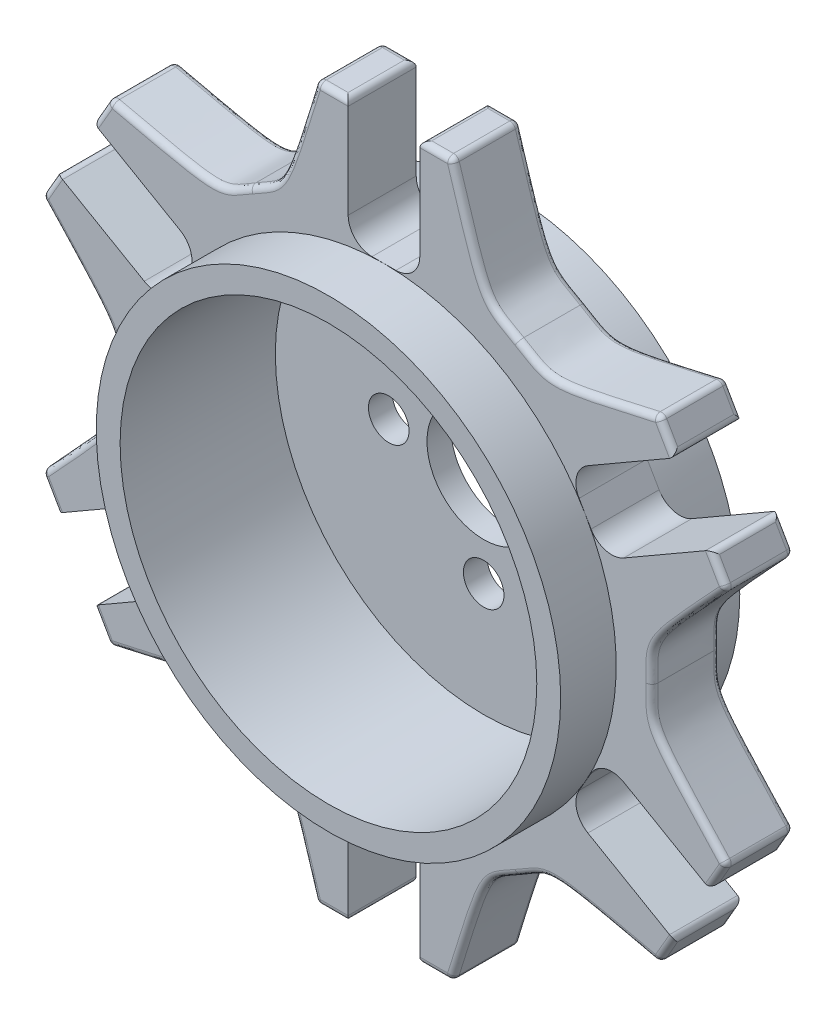
from build123d import *

# Parameters (mm, degrees)
SKETCH_1_R                       = 19.45
EXTRUDE_1_DEPTH                  = 15
SHELL_1_T                        = -2
SKETCH_2_R                       = 4.75
SKETCH_2_R_2                     = 1.7
CUT_EXTRUDE_2_DEPTH              = 15
EXTRUDE_4_DEPTH                  = 2.85
FILLET_2_R                       = 0.5
PATTERN_CIRCULAR_8_COUNT         = 6
FILLET_2_OF_PATTERN_CIRCULAR_8_R = 0.5


with BuildPart() as part:
    # 草圖1 → 伸長1 (new body)
    with BuildSketch(Plane.XY):
        Circle(SKETCH_1_R)
    extrude(amount=EXTRUDE_1_DEPTH)

    # 薄殼1
    shell_1_openings = [part.faces().sort_by_distance(p)[0] for p in [
        (0, 0, 15),
    ]]
    offset(amount=SHELL_1_T, openings=shell_1_openings, kind=Kind.INTERSECTION)

    # 草圖2 → 伸長2 (cut)
    with BuildSketch(Plane(origin=(0, 0, 0), x_dir=(-1, 0, 0), z_dir=(0, 0, -1))):
        Circle(SKETCH_2_R)
        with Locations((0, 7.95)):
            Circle(SKETCH_2_R_2)
        with Locations((7.95, 0)):
            Circle(SKETCH_2_R_2)
        with Locations((0, -7.95)):
            Circle(SKETCH_2_R_2)
        with Locations((-7.95, 0)):
            Circle(SKETCH_2_R_2)
    extrude(amount=-CUT_EXTRUDE_2_DEPTH, mode=Mode.SUBTRACT)

    # 草圖3 → 伸長4 (add, symmetric)
    with BuildSketch(Plane(origin=(0, 0, 7.5), x_dir=(-1, 0, 0), z_dir=(0, 0, -1))):
        with BuildLine():
            Line((0, 19.45), (-1, 19.45))
            ThreePointArc((-1, 19.45), (-2.414214, 20.035786), (-3, 21.45))
            Line((-3, 21.45), (-3, 29.85))
            Line((-3, 29.85), (-5.7, 29.85))
            add(Edge.make_bspline(
                [(-5.7, 29.85), (-8.656431, 20.297015), (-8.338249, 21.108937), (-11.225, 19.44227)],
                knots=[0, 0, 0, 0, 0.52225, 0.52225, 0.52225, 0.52225], degree=3))
            add(Edge.make_bspline(
                [(-23.000858, 19.861345), (-13.249515, 17.645197), (-14.111751, 17.775604), (-11.225, 19.44227)],
                knots=[0, 0, 0, 0, 0.52225, 0.52225, 0.52225, 0.52225], degree=3))
            Line((-23.000858, 19.861345), (-24.350858, 17.523076))
            Line((-24.350858, 17.523076), (-17.076245, 13.323076))
            ThreePointArc((-17.076245, 13.323076), (-16.144393, 12.108663), (-16.344194, 10.591025))
            Line((-16.344194, 10.591025), (-16.844194, 9.725))
            ThreePointArc((-16.844194, 9.725), (-9.725, 16.844194), (0, 19.45))
        make_face()
    extrude_4 = extrude(amount=EXTRUDE_4_DEPTH, both=True)

    # 圓角2
    fillet_2_edges = [part.edges().sort_by_distance(p)[0] for p in [
        (17.025827, 18.54078, 10.35),
        (17.025827, 18.54078, 4.65),
        (7.543873, 24.015189, 10.35),
        (7.543873, 24.015189, 4.65),
        (4.35, 29.85, 10.35),
        (3, 29.85, 7.5),
        (4.35, 29.85, 4.65),
        (5.7, 29.85, 8.925),
        (23.675858, 18.692211, 10.35),
        (23.000858, 19.861345, 6.075),
        (23.675858, 18.692211, 4.65),
        (24.350858, 17.523076, 7.5),
    ]]
    fillet(fillet_2_edges, radius=FILLET_2_R)

    # 環狀複製排列8: 伸長4 ×6 about axis
    pattern_circular_8_axis = Axis((0, 0, 15), (0, 0, -1))
    for i in range(1, PATTERN_CIRCULAR_8_COUNT):
        add(extrude_4.rotate(pattern_circular_8_axis, i * 360 / PATTERN_CIRCULAR_8_COUNT))

    # 圓角2 of 環狀複製排列8
    fillet_2_of_pattern_circular_8_edges = [part.edges().sort_by_distance(p)[0] for p in [
        (24.5697, -5.474409, 10.35),
        (24.5697, -5.474409, 4.65),
        (24.5697, 5.474409, 10.35),
        (24.5697, 5.474409, 4.65),
        (28.025858, 11.157789, 10.35),
        (27.350858, 12.326924, 7.5),
        (28.025858, 11.157789, 4.65),
        (28.700858, 9.988655, 8.925),
        (28.025858, -11.157789, 10.35),
        (28.700858, -9.988655, 6.075),
        (28.025858, -11.157789, 4.65),
        (27.350858, -12.326924, 7.5),
        (7.543873, -24.015189, 10.35),
        (7.543873, -24.015189, 4.65),
        (17.025827, -18.54078, 10.35),
        (17.025827, -18.54078, 4.65),
        (23.675858, -18.692211, 10.35),
        (24.350858, -17.523076, 7.5),
        (23.675858, -18.692211, 4.65),
        (23.000858, -19.861345, 8.925),
        (4.35, -29.85, 10.35),
        (5.7, -29.85, 6.075),
        (4.35, -29.85, 4.65),
        (3, -29.85, 7.5),
        (-17.025827, -18.54078, 10.35),
        (-17.025827, -18.54078, 4.65),
        (-7.543873, -24.015189, 10.35),
        (-7.543873, -24.015189, 4.65),
        (-4.35, -29.85, 10.35),
        (-3, -29.85, 7.5),
        (-4.35, -29.85, 4.65),
        (-5.7, -29.85, 8.925),
        (-23.675858, -18.692211, 10.35),
        (-23.000858, -19.861345, 6.075),
        (-23.675858, -18.692211, 4.65),
        (-24.350858, -17.523076, 7.5),
        (-24.5697, 5.474409, 10.35),
        (-24.5697, 5.474409, 4.65),
        (-24.5697, -5.474409, 10.35),
        (-24.5697, -5.474409, 4.65),
        (-28.025858, -11.157789, 10.35),
        (-27.350858, -12.326924, 7.5),
        (-28.025858, -11.157789, 4.65),
        (-28.700858, -9.988655, 8.925),
        (-28.025858, 11.157789, 10.35),
        (-28.700858, 9.988655, 6.075),
        (-28.025858, 11.157789, 4.65),
        (-27.350858, 12.326924, 7.5),
        (-7.543873, 24.015189, 10.35),
        (-7.543873, 24.015189, 4.65),
        (-17.025827, 18.54078, 10.35),
        (-17.025827, 18.54078, 4.65),
        (-23.675858, 18.692211, 10.35),
        (-24.350858, 17.523076, 7.5),
        (-23.675858, 18.692211, 4.65),
        (-23.000858, 19.861345, 8.925),
        (-4.35, 29.85, 10.35),
        (-5.7, 29.85, 6.075),
        (-4.35, 29.85, 4.65),
        (-3, 29.85, 7.5),
    ]]
    fillet(fillet_2_of_pattern_circular_8_edges, radius=FILLET_2_OF_PATTERN_CIRCULAR_8_R)


solid = part.part
